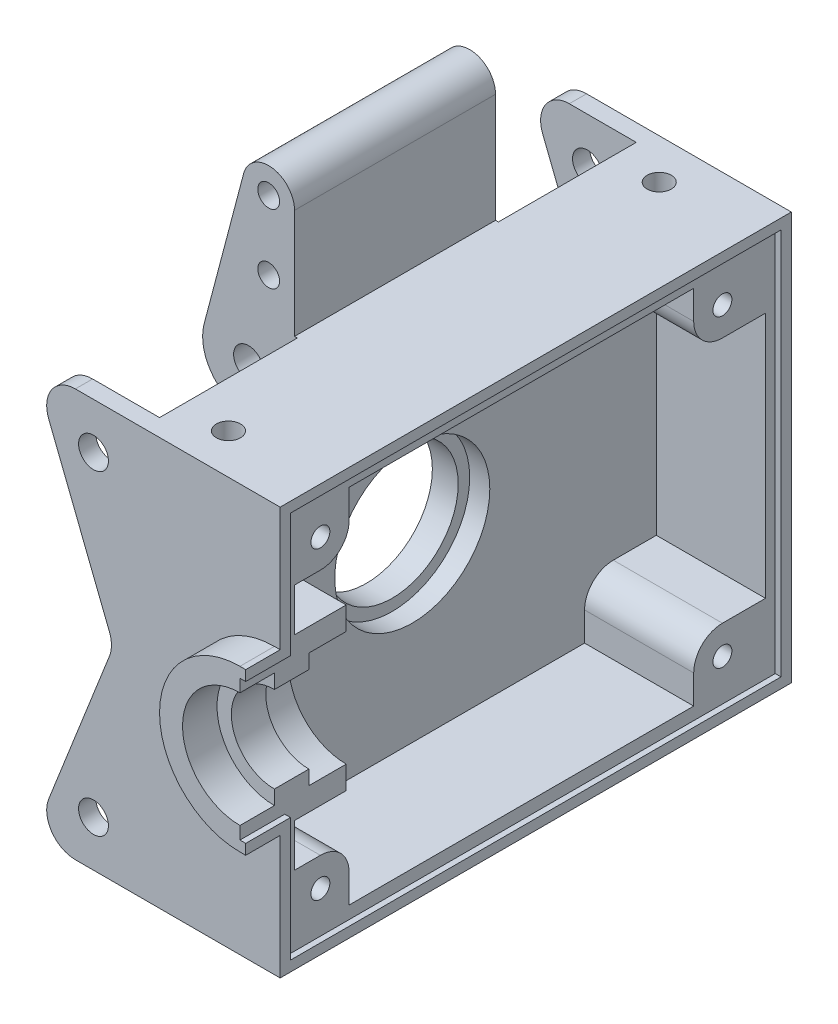
from build123d import *

# Parameters (mm, degrees)
SKETCH_1_W             = 46
SKETCH_1_H             = 89
EXTRUDE_1_DEPTH        = 35.5
SKETCH_3_R             = 2.6
EXTRUDE_2_DEPTH        = 3
EXTRUDE_START          = -3
SKETCH_4_R             = 2.6
EXTRUDE_3_DEPTH        = 3
SKETCH_5_R             = 14
EXTRUDE_4_DEPTH        = 6
SKETCH_6_R             = 11.5
CUT_EXTRUDE_1_DEPTH    = 88.954242748
SKETCH_7_R             = 2.6
EXTRUDE_5_DEPTH        = 17.5
SKETCH_8_R             = 1.9
SKETCH_8_R_2           = 4.5
EXTRUDE_6_DEPTH        = 17.5
SKETCH_9_R             = 2
CUT_EXTRUDE_2_DEPTH    = 115.249255194
SKETCH_10_R            = 10
CUT_EXTRUDE_3_DEPTH    = 6
SKETCH_11_R            = 7.5
CUT_EXTRUDE_4_DEPTH    = 6
SKETCH_12_R            = 9.5
CUT_EXTRUDE_5_DEPTH    = 6
SKETCH_15_W            = 38
SKETCH_15_H            = 63
CUT_EXTRUDE_7_DEPTH    = 41
EXTRUDE_START_2        = 9
SKETCH_16_R            = 14
SKETCH_16_R_2          = 9.5
EXTRUDE_7_DEPTH        = 9
SKETCH_17_R            = 5
EXTRUDE_10_DEPTH       = 20
EXTRUDE_START_3        = 4
SKETCH_18_W            = 35
SKETCH_18_H            = 55
SKETCH_18_R            = 11.5
EXTRUDE_11_DEPTH       = 4
SKETCH_19_R            = 13.5
CUT_EXTRUDE_10_DEPTH   = 4
CUT_EXTRUDE_START      = -3.5
SKETCH_20_R            = 13.5
CUT_EXTRUDE_11_DEPTH   = 3.5
SKETCH_22_W            = 152.706647992
SKETCH_22_H            = 164.74218493
CUT_EXTRUDE_14_DEPTH   = 500
EXTRUDE_12_DEPTH       = 1
HOLE_WIZARD_M4_1_D     = 3.3
HOLE_WIZARD_M4_1_DEPTH = 20
HOLE_WIZARD_M4_1_TIP   = 0.991420021
EXTRUDE_14_DEPTH       = 2.5
CUT_EXTRUDE_START_2    = -6.5
SKETCH_28_R            = 10
CUT_EXTRUDE_15_DEPTH   = 6.5


# Read off the part's stored shape, not the designer's step: M5 螺纹孔1
with BuildPart() as part:
    # 草图1 → 凸台-拉伸1 (new, symmetric)
    with BuildSketch(Plane(origin=(0, 0, 0), x_dir=(1, 0, 0), z_dir=(0, 1, 0))):
        Rectangle(SKETCH_1_W, SKETCH_1_H)
    extrude(amount=EXTRUDE_1_DEPTH, both=True)

    # 草图3 → 凸台-拉伸2 (add)
    # profile 1 of 2: a face of its own
    with BuildSketch(Plane.XY.offset(44.5)):
        with BuildLine():
            Line((23, 35.5), (34.653402281, 35.5))
            ThreePointArc((34.653402281, 35.5), (38.786905937, 33.313209471), (39.304766934, 28.66565901))
            Line((39.304766934, 28.66565901), (28.72340208, 1.83434099))
            ThreePointArc((28.72340208, 1.83434099), (28.374766733, 0), (28.72340208, -1.83434099))
            Line((28.72340208, -1.83434099), (39.304766934, -28.66565901))
            ThreePointArc((39.304766934, -28.66565901), (38.786905937, -33.313209471), (34.653402281, -35.5))
            Line((34.653402281, -35.5), (23, -35.5))
            Line((23, -35.5), (23, 35.5))
        make_face()
        with Locations((31.5, 27.5)):
            Circle(SKETCH_3_R, mode=Mode.SUBTRACT)
        with Locations((31.5, -27.5)):
            Circle(SKETCH_3_R, mode=Mode.SUBTRACT)
    # profile 2 of 2: a face of its own
    with BuildSketch(Plane.XY.offset(44.5)):
        with BuildLine():
            Line((-23, -35.5), (-23, 35.5))
            Line((-23, 35.5), (-34.653402281, 35.5))
            ThreePointArc((-34.653402281, 35.5), (-38.786905937, 33.313209471), (-39.304766934, 28.66565901))
            Line((-39.304766934, 28.66565901), (-28.72340208, 1.83434099))
            ThreePointArc((-28.72340208, 1.83434099), (-28.374766733, 0), (-28.72340208, -1.83434099))
            Line((-28.72340208, -1.83434099), (-39.304766934, -28.66565901))
            ThreePointArc((-39.304766934, -28.66565901), (-38.786905937, -33.313209471), (-34.653402281, -35.5))
            Line((-34.653402281, -35.5), (-23, -35.5))
        make_face()
        with Locations((-31.5, -27.5)):
            Circle(SKETCH_3_R, mode=Mode.SUBTRACT)
        with Locations((-31.5, 27.5)):
            Circle(SKETCH_3_R, mode=Mode.SUBTRACT)
    extrude(amount=-EXTRUDE_2_DEPTH)

    # 草图4 → 凸台-拉伸3 (add)
    # profile 1 of 2: a face of its own
    with BuildSketch(Plane(origin=(0, 0, -44.5), x_dir=(-1, 0, 0), z_dir=(0, 0, -1)).offset(EXTRUDE_START)):
        with BuildLine():
            Line((39.304766934, -28.66565901), (28.72340208, -1.83434099))
            ThreePointArc((28.72340208, -1.83434099), (28.374766733, 0), (28.72340208, 1.83434099))
            Line((28.72340208, 1.83434099), (39.304766934, 28.66565901))
            ThreePointArc((39.304766934, 28.66565901), (38.786905937, 33.313209471), (34.653402281, 35.5))
            Line((34.653402281, 35.5), (23, 35.5))
            Line((23, 35.5), (23, -35.5))
            Line((23, -35.5), (34.653402281, -35.5))
            ThreePointArc((34.653402281, -35.5), (38.786905937, -33.313209471), (39.304766934, -28.66565901))
        make_face()
        with Locations(Location((31.5, 27.5, 0), (0, 0, 180))):
            Circle(SKETCH_4_R, mode=Mode.SUBTRACT)
        with Locations(Location((31.5, -27.5, 0), (0, 0, 180))):
            Circle(SKETCH_4_R, mode=Mode.SUBTRACT)
    # profile 2 of 2: a face of its own
    with BuildSketch(Plane(origin=(0, 0, -44.5), x_dir=(-1, 0, 0), z_dir=(0, 0, -1)).offset(EXTRUDE_START)):
        with BuildLine():
            Line((-23, 35.5), (-34.653402281, 35.5))
            ThreePointArc((-34.653402281, 35.5), (-38.786905937, 33.313209471), (-39.304766934, 28.66565901))
            Line((-39.304766934, 28.66565901), (-28.72340208, 1.83434099))
            ThreePointArc((-28.72340208, 1.83434099), (-28.374766733, 0), (-28.72340208, -1.83434099))
            Line((-28.72340208, -1.83434099), (-39.304766934, -28.66565901))
            ThreePointArc((-39.304766934, -28.66565901), (-38.786905937, -33.313209471), (-34.653402281, -35.5))
            Line((-34.653402281, -35.5), (-23, -35.5))
            Line((-23, -35.5), (-23, 35.5))
        make_face()
        with Locations(Location((-31.5, -27.5, 0), (0, 0, 180))):
            Circle(SKETCH_4_R, mode=Mode.SUBTRACT)
        with Locations(Location((-31.5, 27.5, 0), (0, 0, 180))):
            Circle(SKETCH_4_R, mode=Mode.SUBTRACT)
    extrude(amount=EXTRUDE_3_DEPTH)

    # 草图5 → 凸台-拉伸4 (add)
    with BuildSketch(Plane.XY.offset(44.5)):
        Circle(SKETCH_5_R)
    extrude(amount=EXTRUDE_4_DEPTH)

    # 草图6 → 切除-拉伸1 (cut, through all)
    with BuildSketch(Plane(origin=(23, 0, 0), x_dir=(0, 0, -1), z_dir=(1, 0, 0))):
        with Locations((-1.5, 0)):
            Circle(SKETCH_6_R)
    extrude(amount=-CUT_EXTRUDE_1_DEPTH, mode=Mode.SUBTRACT)

    # 草图7 → 凸台-拉伸5 (add, symmetric)
    with BuildSketch(Plane.XY):
        with BuildLine():
            Line((23, 19.5), (23, 35.5))
            Line((23, 35.5), (31.5, 35.5))
            ThreePointArc((31.5, 35.5), (39.5, 27.5), (31.5, 19.5))
            Line((31.5, 19.5), (23, 19.5))
        make_face()
        with Locations((31.5, 27.5)):
            Circle(SKETCH_7_R, mode=Mode.SUBTRACT)
    extrude_5 = extrude(amount=EXTRUDE_5_DEPTH, both=True)

    # 镜向1: 凸台-拉伸5 across plane
    add(extrude_5.mirror(Plane(origin=(0, 0, 0), x_dir=(0, 0, 1), z_dir=(1, 0, 0))))

    # 草图8 → 凸台-拉伸6 (add, symmetric)
    # profile 1 of 2: a face of its own
    with BuildSketch(Plane.XY):
        with BuildLine():
            Line((39.235581788, 29.539797639), (32.351264755, 55.647386172))
            ThreePointArc((32.351264755, 55.647386172), (32.46266128, 55.078493129), (32.5, 54.5))
            ThreePointArc((32.5, 54.5), (28, 50), (23.5, 54.5))
            Line((23.5, 54.5), (23.5, 35.5))
            Line((23.5, 35.5), (31.5, 35.5))
            ThreePointArc((31.5, 35.5), (36.382705136, 33.837127942), (39.235581788, 29.539797639))
        make_face()
        with Locations((28, 42.5)):
            Circle(SKETCH_8_R, mode=Mode.SUBTRACT)
    # profile 2 of 2: a face of its own
    with BuildSketch(Plane.XY):
        with Locations((28, 54.5)):
            Circle(SKETCH_8_R_2)
        with Locations((28, 54.5)):
            Circle(SKETCH_8_R, mode=Mode.SUBTRACT)
    extrude_6 = extrude(amount=EXTRUDE_6_DEPTH, both=True)

    # 镜向2: 凸台-拉伸5, 凸台-拉伸6 across plane
    add(extrude_5.mirror(Plane(origin=(0, 0, 0), x_dir=(0, 0, 1), z_dir=(1, 0, 0))))
    add(extrude_6.mirror(Plane(origin=(0, 0, 0), x_dir=(0, 0, 1), z_dir=(1, 0, 0))))

    # 草图9 → 切除-拉伸2 (cut, through all)
    with BuildSketch(Plane.XZ.offset(35.5)):
        with Locations(Location((15, -37.5, 0), (0, 0, 270))):
            Circle(SKETCH_9_R)
        with Locations(Location((-15, -37.5, 0), (0, 0, 270))):
            Circle(SKETCH_9_R)
        with Locations(Location((-15, 37.5, 0), (0, 0, 270))):
            Circle(SKETCH_9_R)
        with Locations(Location((15, 37.5, 0), (0, 0, 270))):
            Circle(SKETCH_9_R)
    extrude(amount=-CUT_EXTRUDE_2_DEPTH, mode=Mode.SUBTRACT)

    # 草图10 → 切除-拉伸3 (cut)
    with BuildSketch(Plane.XY.offset(50.5)):
        Circle(SKETCH_10_R)
    extrude(amount=-CUT_EXTRUDE_3_DEPTH, mode=Mode.SUBTRACT)

    # 草图11 → 切除-拉伸4 (cut)
    with BuildSketch(Plane.XY.offset(44.5)):
        Circle(SKETCH_11_R)
    extrude(amount=-CUT_EXTRUDE_4_DEPTH, mode=Mode.SUBTRACT)

    # 草图12 → 切除-拉伸5 (cut)
    with BuildSketch(Plane.XY.offset(38.5)):
        Circle(SKETCH_12_R)
    extrude(amount=-CUT_EXTRUDE_5_DEPTH, mode=Mode.SUBTRACT)

    # 草图15 → 切除-拉伸7 (cut, symmetric)
    with BuildSketch(Plane.XY):
        Rectangle(SKETCH_15_W, SKETCH_15_H)
    extrude(amount=CUT_EXTRUDE_7_DEPTH, both=True, mode=Mode.SUBTRACT)

    # 草图16 → 凸台-拉伸7 (add)
    # profile 1 of 3: a face of its own
    with BuildSketch(Plane(origin=(0, 0, 41), x_dir=(-1, 0, 0), z_dir=(0, 0, -1)).offset(EXTRUDE_START_2)):
        with Locations(Location((0, 0, 0), (0, 0, 180))):
            Circle(SKETCH_16_R)
        Circle(SKETCH_16_R_2, mode=Mode.SUBTRACT)
    # profile 2 of 3: a face of its own
    with BuildSketch(Plane(origin=(0, 0, 41), x_dir=(-1, 0, 0), z_dir=(0, 0, -1)).offset(EXTRUDE_START_2)):
        with BuildLine():
            Line((-19, 14), (-19, -14))
            Line((-19, -14), (0, -14))
            ThreePointArc((0, -14), (-14, 0), (0, 14))
            Line((0, 14), (-19, 14))
        make_face()
    # profile 3 of 3: a face of its own
    with BuildSketch(Plane(origin=(0, 0, 41), x_dir=(-1, 0, 0), z_dir=(0, 0, -1)).offset(EXTRUDE_START_2)):
        with BuildLine():
            ThreePointArc((14, 0), (9.899494937, -9.899494937), (0, -14))
            Line((0, -14), (19, -14))
            Line((19, -14), (19, 14))
            Line((19, 14), (0, 14))
            ThreePointArc((0, 14), (9.899494937, 9.899494937), (14, 0))
        make_face()
    extrude(amount=-EXTRUDE_7_DEPTH)

    # 草图17 → 凸台-拉伸10 (add, symmetric)
    with BuildSketch(Plane(origin=(0, 0, 0), x_dir=(0, 0, -1), z_dir=(1, 0, 0))):
        with BuildLine():
            ThreePointArc((-41, 28.679449472), (-39.155442773, 30.736581603), (-36.5, 31.5))
            Line((-36.5, 31.5), (-41, 31.5))
            Line((-41, 31.5), (-41, 28.679449472))
        make_face()
        with BuildLine():
            ThreePointArc((-36.5, 21.5), (-32.964466094, 22.964466094), (-31.5, 26.5))
            ThreePointArc((-31.5, 26.5), (-32.964466094, 30.035533906), (-36.5, 31.5))
            ThreePointArc((-36.5, 31.5), (-39.155442773, 30.736581603), (-41, 28.679449472))
            Line((-41, 28.679449472), (-41, 24.320550528))
            ThreePointArc((-41, 24.320550528), (-39.155442773, 22.263418397), (-36.5, 21.5))
        make_face()
        with BuildLine():
            ThreePointArc((-41, 28.679449472), (-41.5, 26.5), (-41, 24.320550528))
            Line((-41, 24.320550528), (-41, 28.679449472))
        make_face()
        with BuildLine():
            ThreePointArc((-36.5, 31.5), (-32.964466094, 30.035533906), (-31.5, 26.5))
            Line((-31.5, 26.5), (-31.5, 31.5))
            Line((-31.5, 31.5), (-36.5, 31.5))
        make_face()
        with BuildLine():
            Line((-41, 21.5), (-36.5, 21.5))
            ThreePointArc((-36.5, 21.5), (-39.155442773, 22.263418397), (-41, 24.320550528))
            Line((-41, 24.320550528), (-41, 21.5))
        make_face()
        with Locations((33.5, 26.5)):
            Circle(SKETCH_17_R)
        with BuildLine():
            Line((33.5, 31.5), (28.5, 31.5))
            Line((28.5, 31.5), (28.5, 26.5))
            ThreePointArc((28.5, 26.5), (29.964466094, 30.035533906), (33.5, 31.5))
        make_face()
        with BuildLine():
            Line((41, 31.5), (33.5, 31.5))
            ThreePointArc((33.5, 31.5), (37.035533906, 30.035533906), (38.5, 26.5))
            ThreePointArc((38.5, 26.5), (37.035533906, 22.964466094), (33.5, 21.5))
            Line((33.5, 21.5), (41, 21.5))
            Line((41, 21.5), (41, 31.5))
        make_face()
        with Locations((33.5, -26.5)):
            Circle(SKETCH_17_R)
        with BuildLine():
            Line((28.5, -31.5), (33.5, -31.5))
            ThreePointArc((33.5, -31.5), (29.964466094, -30.035533906), (28.5, -26.5))
            Line((28.5, -26.5), (28.5, -31.5))
        make_face()
        with BuildLine():
            Line((41, -31.5), (41, -21.5))
            Line((41, -21.5), (33.5, -21.5))
            ThreePointArc((33.5, -21.5), (37.035533906, -22.964466094), (38.5, -26.5))
            ThreePointArc((38.5, -26.5), (37.035533906, -30.035533906), (33.5, -31.5))
            Line((33.5, -31.5), (41, -31.5))
        make_face()
        with BuildLine():
            Line((-31.5, -31.5), (-31.5, -26.5))
            ThreePointArc((-31.5, -26.5), (-32.964466094, -30.035533906), (-36.5, -31.5))
            Line((-36.5, -31.5), (-31.5, -31.5))
        make_face()
        with BuildLine():
            ThreePointArc((-31.5, -26.5), (-32.964466094, -22.964466094), (-36.5, -21.5))
            ThreePointArc((-36.5, -21.5), (-39.155442773, -22.263418397), (-41, -24.320550528))
            Line((-41, -24.320550528), (-41, -28.679449472))
            ThreePointArc((-41, -28.679449472), (-39.155442773, -30.736581603), (-36.5, -31.5))
            ThreePointArc((-36.5, -31.5), (-32.964466094, -30.035533906), (-31.5, -26.5))
        make_face()
        with BuildLine():
            Line((-41, -28.679449472), (-41, -24.320550528))
            ThreePointArc((-41, -24.320550528), (-41.5, -26.5), (-41, -28.679449472))
        make_face()
        with BuildLine():
            Line((-36.5, -21.5), (-41, -21.5))
            Line((-41, -21.5), (-41, -24.320550528))
            ThreePointArc((-41, -24.320550528), (-39.155442773, -22.263418397), (-36.5, -21.5))
        make_face()
        with BuildLine():
            ThreePointArc((-36.5, -31.5), (-39.155442773, -30.736581603), (-41, -28.679449472))
            Line((-41, -28.679449472), (-41, -31.5))
            Line((-41, -31.5), (-36.5, -31.5))
        make_face()
    extrude(amount=EXTRUDE_10_DEPTH, both=True)

    # 草图18 → 凸台-拉伸11 (add)
    with BuildSketch(Plane(origin=(23, 0, 0), x_dir=(0, 0, -1), z_dir=(1, 0, 0)).offset(EXTRUDE_START_3)):
        with Locations((0, -8)):
            Rectangle(SKETCH_18_W, SKETCH_18_H)
        with Locations((-1.5, 0)):
            Circle(SKETCH_18_R, mode=Mode.SUBTRACT)
    extrude_11 = extrude(amount=-EXTRUDE_11_DEPTH)

    # 镜向3: 凸台-拉伸11 across plane
    add(extrude_11.mirror(Plane(origin=(0, 0, 0), x_dir=(0, 0, 1), z_dir=(1, 0, 0))))

    # 草图19 → 切除-拉伸10 (cut)
    with BuildSketch(Plane.ZY.offset(-19)):
        with Locations(Location((1.5, 0, 0), (0, 0, 270))):
            Circle(SKETCH_19_R)
    extrude(amount=-CUT_EXTRUDE_10_DEPTH, mode=Mode.SUBTRACT)

    # 草图20 → 切除-拉伸11 (cut)
    with BuildSketch(Plane(origin=(-19, 0, 0), x_dir=(0, 0, -1), z_dir=(1, 0, 0)).offset(CUT_EXTRUDE_START)):
        with Locations(Location((-1.5, 0, 0), (0, 0, 270))):
            Circle(SKETCH_20_R)
    extrude(amount=CUT_EXTRUDE_11_DEPTH, mode=Mode.SUBTRACT)

    # 草图22 → 切除-拉伸14 (cut)
    with BuildSketch(Plane.XY.offset(50.5)):
        with Locations((76.353323996, 0)):
            Rectangle(SKETCH_22_W, SKETCH_22_H)
    extrude(amount=-CUT_EXTRUDE_14_DEPTH, mode=Mode.SUBTRACT)

    # 草图23 → 凸台-拉伸12 (add)
    with BuildSketch(Plane(origin=(0, 0, 0), x_dir=(0, 0, -1), z_dir=(1, 0, 0))):
        Polygon((-50.5, 14), (-50.5, 12.2), (-42.7, 12.2), (-42.7, 33.7), (42.7, 33.7), (42.7, -33.7), (-42.7, -33.7), (-42.7, -12.2), (-50.5, -12.2), (-50.5, -14), (-44.5, -14), (-44.5, -35.5), (44.5, -35.5), (44.5, 35.5), (-44.5, 35.5), (-44.5, 14), align=None)
    extrude(amount=EXTRUDE_12_DEPTH)

    # M4 螺纹孔1
    with Locations(Plane(origin=(0, -26.5, -33.5), x_dir=(0, 0, 1), z_dir=(1, 0, 0))):
        with Locations((0, 0), (70, 0), (70, -53), (0, -53)):
            Hole(HOLE_WIZARD_M4_1_D / 2, depth=HOLE_WIZARD_M4_1_DEPTH)
            with Locations((0, 0, -(HOLE_WIZARD_M4_1_DEPTH + HOLE_WIZARD_M4_1_TIP / 2))):  # 118° drill point
                Cone(0, HOLE_WIZARD_M4_1_D / 2, HOLE_WIZARD_M4_1_TIP, mode=Mode.SUBTRACT)

    # M5 螺纹孔1 outline → M5 螺纹孔1 (revolve, cut)
    with BuildSketch(Plane(origin=(-15, 0, -37.5), x_dir=(1, 0, 0), z_dir=(0, 0, 1))):
        Polygon((0, -24.2381927), (0, -31.5), (2, -31.5), (2, -35.5), (2.1, -35.5), (2.1, -25.5), align=None)
        Polygon((0, 31.5), (0, 24.2381927), (2.1, 25.5), (2.1, 35.5), (2, 35.5), (2, 31.5), align=None)
    revolve(axis=Axis((-15, 0, -37.5), (0, 1, 0)), mode=Mode.SUBTRACT)

    # Hole Wizard M5 _1 2 outline → Hole Wizard M5 _1 2 (revolve, cut)
    with BuildSketch(Plane(origin=(-15, 0, 37.5), x_dir=(1, 0, 0), z_dir=(0, 0, 1))):
        Polygon((0, -24.2381927), (0, -31.5), (2, -31.5), (2, -35.5), (2.100000029, -35.5), (2.10000001, -25.500000006), align=None)
        Polygon((0, 31.5), (0, 24.2381927), (2.10000001, 25.500000006), (2.100000015, 35.5), (2, 35.5), (2, 31.5), align=None)
    revolve(axis=Axis((-15, 0, 37.5), (0, 1, 0)), mode=Mode.SUBTRACT)

    # 草图27 → 凸台-拉伸14 (add)
    with BuildSketch(Plane(origin=(0, 0, 41), x_dir=(-1, 0, 0), z_dir=(0, 0, -1))):
        with BuildLine():
            Line((0, -7.5), (0, -9.5))
            ThreePointArc((0, -9.5), (9.5, 0), (0, 9.5))
            Line((0, 9.5), (0, 7.5))
            ThreePointArc((0, 7.5), (7.5, 0), (0, -7.5))
        make_face()
    extrude(amount=EXTRUDE_14_DEPTH)

    # 草图28 → 切除-拉伸15 (cut)
    with BuildSketch(Plane(origin=(0, 0, 32), x_dir=(-1, 0, 0), z_dir=(0, 0, -1)).offset(CUT_EXTRUDE_START_2)):
        Circle(SKETCH_28_R)
    extrude(amount=CUT_EXTRUDE_15_DEPTH, mode=Mode.SUBTRACT)


solid = part.part
